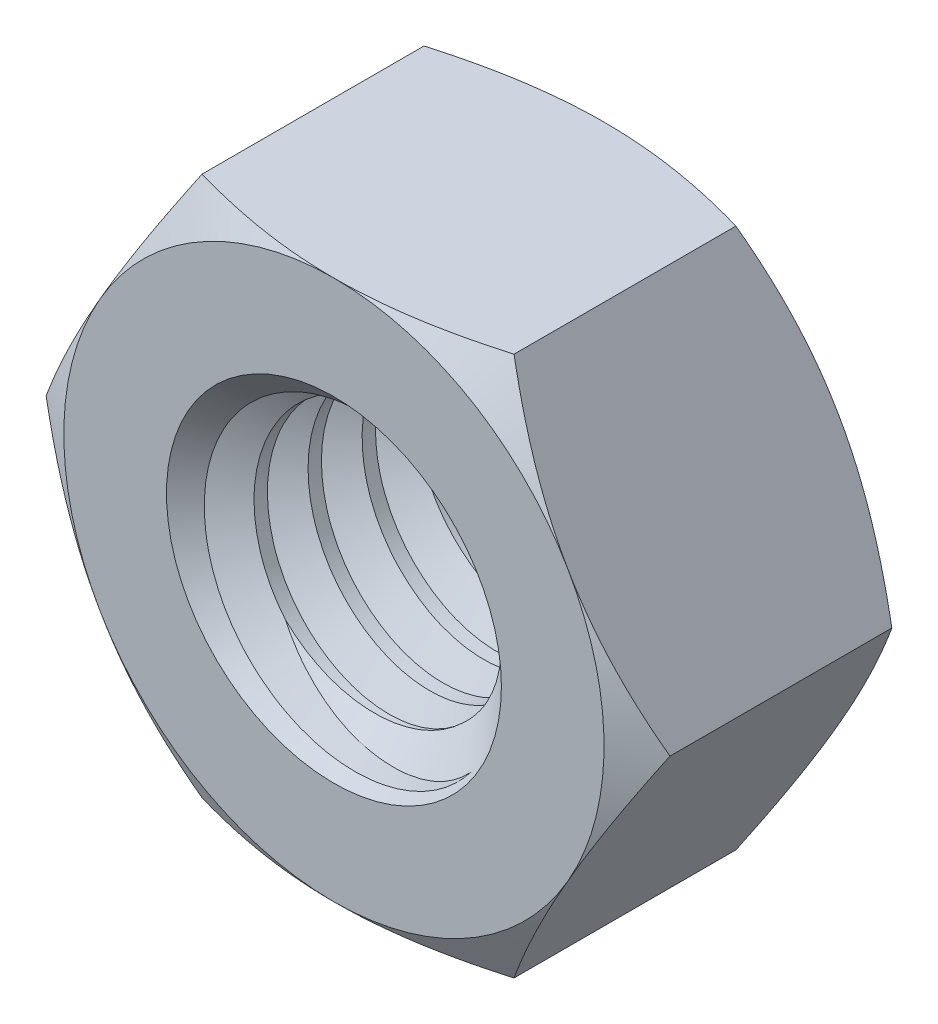
from build123d import *

# Parameters (mm, degrees)
Y_KSEKLIK_EKSTR_ZYON1_DEPTH = 5
IZIM2_OUTSIDE_W             = 34.084
IZIM2_OUTSIDE_H             = 32.536
IZIM2_OUTSIDE_R             = 5
KES_EKSTR_ZYON1_DEPTH       = 5
KES_EKSTR_ZYON1_DRAFT       = -60
IZIM3_OUTSIDE_W             = 34.084
IZIM3_OUTSIDE_H             = 32.536
IZIM3_OUTSIDE_R             = 5
KES_EKSTR_ZYON2_DEPTH       = 5
KES_EKSTR_ZYON2_DRAFT       = -60
IZIM4_R                     = 2.35
KES_EKSTR_ZYON3_DEPTH       = 5
PAH1_SIZE                   = 0.75
KES_S_P_R1_PITCH            = 1


with BuildPart() as part:
    # Çizim1 → Yükseklik-Ekstrüzyon1 (new body)
    with BuildSketch(Plane.XY):
        Polygon((5.773502692, 0), (2.886751346, 5), (-2.886751346, 5), (-5.773502692, 0), (-2.886751346, -5), (2.886751346, -5), align=None)
    extrude(amount=Y_KSEKLIK_EKSTR_ZYON1_DEPTH)


with BuildPart() as kes_ekstr_zyon1_tool:
    # Çizim2 outside → Kes-Ekstrüzyon1 (with draft: the straight prism first)
    with BuildSketch(Plane.XY.offset(5)):
        Rectangle(IZIM2_OUTSIDE_W, IZIM2_OUTSIDE_H)
        Circle(IZIM2_OUTSIDE_R, mode=Mode.SUBTRACT)
    extrude(amount=-KES_EKSTR_ZYON1_DEPTH)
    # Kes-Ekstrüzyon1: the draft: its side faces are tilted about the plane it starts from
    kes_ekstr_zyon1_sides = [kes_ekstr_zyon1_tool.faces().sort_by_distance(p)[0] for p in [
        (0, -16.268, 2.5),
        (17.042, 0, 2.5),
        (0, 16.268, 2.5),
        (-17.042, 0, 2.5),
        (-5, 0, 2.5),
    ]]
    draft(kes_ekstr_zyon1_sides, Plane.XY.offset(5), KES_EKSTR_ZYON1_DRAFT)


with BuildPart() as part_1:
    add(part.part)

    # Kes-Ekstrüzyon1: cut by kes_ekstr_zyon1_tool
    add(kes_ekstr_zyon1_tool.part, mode=Mode.SUBTRACT)


with BuildPart() as kes_ekstr_zyon2_tool:
    # Çizim3 outside → Kes-Ekstrüzyon2 (with draft: the straight prism first)
    with BuildSketch(Plane(origin=(0, 0, 0), x_dir=(-1, 0, 0), z_dir=(0, 0, -1))):
        Rectangle(IZIM3_OUTSIDE_W, IZIM3_OUTSIDE_H)
        Circle(IZIM3_OUTSIDE_R, mode=Mode.SUBTRACT)
    extrude(amount=-KES_EKSTR_ZYON2_DEPTH)
    # Kes-Ekstrüzyon2: the draft: its side faces are tilted about the plane it starts from
    kes_ekstr_zyon2_sides = [kes_ekstr_zyon2_tool.faces().sort_by_distance(p)[0] for p in [
        (0, -16.268, 2.5),
        (-17.042, 0, 2.5),
        (0, 16.268, 2.5),
        (17.042, 0, 2.5),
        (5, 0, 2.5),
    ]]
    draft(kes_ekstr_zyon2_sides, Plane(origin=(0, 0, 0), x_dir=(-1, 0, 0), z_dir=(0, 0, -1)), KES_EKSTR_ZYON2_DRAFT)


with BuildPart() as part_2:
    add(part_1.part)

    # Kes-Ekstrüzyon2: cut by kes_ekstr_zyon2_tool
    add(kes_ekstr_zyon2_tool.part, mode=Mode.SUBTRACT)

    # Çizim4 → Kes-Ekstrüzyon3 (cut)
    with BuildSketch(Plane(origin=(0, 0, 0), x_dir=(-1, 0, 0), z_dir=(0, 0, -1))):
        Circle(IZIM4_R)
    extrude(amount=-KES_EKSTR_ZYON3_DEPTH, mode=Mode.SUBTRACT)

    # Pah1
    pah1_edges = [part_2.edges().sort_by_distance(p)[0] for p in [
        (2.35, 0, 5),
        (2.35, 0, 0),
    ]]
    chamfer(pah1_edges, length=PAH1_SIZE)

    # Kes-Süpür1: arcs per turn and ends read off the stored shape
    # Kes-Süpür1: the profile of Çizim6 screwed along a right-hand helix through 6 turns, 8 arcs to a turn; built about Z, then put on its axis
    kes_s_p_r1_z = Axis((0, 0, 0), (0, 0, 1))
    kes_s_p_r1_corners = [(3, 0, 0), (2.15612732, 0.032921139, -0.486096594), (2.15612732, -0.032921139, 0.486096594)]
    with BuildLine(mode=Mode.PRIVATE) as kes_s_p_r1_profile:
        Line(kes_s_p_r1_corners[0], kes_s_p_r1_corners[1])
        Line(kes_s_p_r1_corners[1], kes_s_p_r1_corners[2])
        Line(kes_s_p_r1_corners[2], kes_s_p_r1_corners[0])
    kes_s_p_r1_cap = Face(kes_s_p_r1_profile.wire())
    kes_s_p_r1_turn_angles = [0, 22.5, 45, 67.5, 90, 112.5, 135, 157.5, 180, 202.5, 225, 247.5, 270, 292.5, 315, 337.5, 360]
    kes_s_p_r1_turn_weights = [1, 0.9238795325112867, 1, 0.9238795325112867, 1, 0.9238795325112867, 1, 0.9238795325112867, 1, 0.9238795325112867, 1, 0.9238795325112867, 1, 0.9238795325112867, 1, 0.9238795325112867, 1]
    kes_s_p_r1_turn_rails = [Edge.make_bspline([Vector(p[0], p[1], 0).rotate(kes_s_p_r1_z, kes_s_p_r1_turn_angles[k]) / kes_s_p_r1_turn_weights[k] + Vector(0, 0, p[2] + KES_S_P_R1_PITCH * kes_s_p_r1_turn_angles[k] / 360) for k in range(17)], [0, 0, 0, 1, 1, 2, 2, 3, 3, 4, 4, 5, 5, 6, 6, 7, 7, 8, 8, 8], 2, kes_s_p_r1_turn_weights) for p in kes_s_p_r1_corners]
    kes_s_p_r1_turn_sides = [Face.make_surface_from_curves(kes_s_p_r1_turn_rails[p[0]], kes_s_p_r1_turn_rails[p[1]]) for p in [(0, 1), (1, 2), (2, 0)]]
    kes_s_p_r1 = Plane(origin=(0, 0, 0), x_dir=(1, 0, 0), z_dir=(0, 0, 1)) * Solid(Shell([*[p.moved(Location((0, 0, KES_S_P_R1_PITCH * i))) for i in range(6) for p in kes_s_p_r1_turn_sides], kes_s_p_r1_cap, kes_s_p_r1_cap.rotate(kes_s_p_r1_z, 2160).moved(Location((0, 0, KES_S_P_R1_PITCH * 2160 / 360)))]))
    add(kes_s_p_r1, mode=Mode.SUBTRACT)


solid = part_2.part
